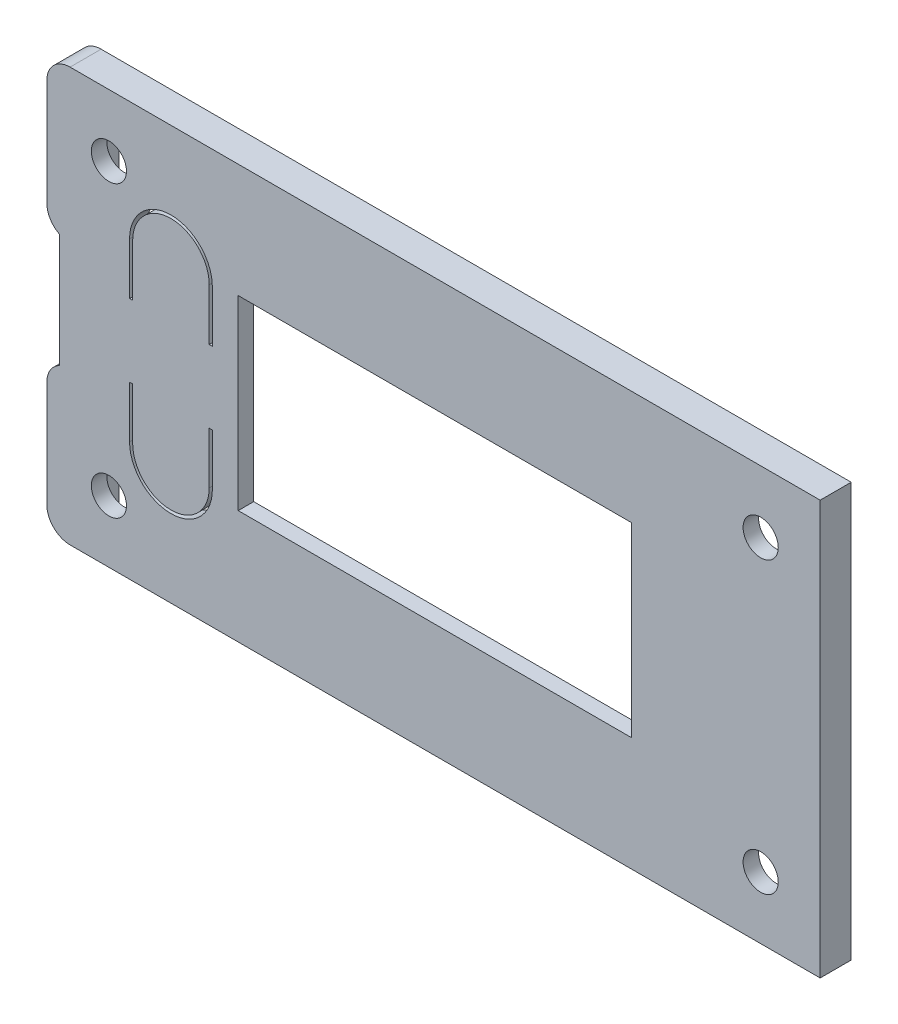
from build123d import *

# Parameters (mm, degrees)
SKETCH1_W           = 74.75
SKETCH1_H           = 40
BOSS_EXTRUDE1_DEPTH = 3
SKETCH2_W           = 2.25
SKETCH2_H           = 10.5
CUT_EXTRUDE1_DEPTH  = 85.832555661
FILLET2_R           = 2.25
FILLET1_R           = 2.25
BOSS_EXTRUDE4_DEPTH = 3.7
SKETCH7_W           = 68.5
SKETCH7_H           = 35.5
OLED_RECESS_DEPTH   = 1.5
SKETCH9_R           = 1.7
SKETCH9_W           = 38
SKETCH9_H           = 18
CUT_EXTRUDE5_DEPTH  = 85.860193848


with BuildPart() as part:
    # Sketch1 → Boss-Extrude1 (new body)
    with BuildSketch(Plane.XY):
        with Locations((37.375, 20)):
            Rectangle(SKETCH1_W, SKETCH1_H)
    extrude(amount=BOSS_EXTRUDE1_DEPTH)

    # Sketch2 → Cut-Extrude1 (cut, through all)
    with BuildSketch(Plane.XY.offset(3)):
        with Locations((1.125, 20)):
            Rectangle(SKETCH2_W, SKETCH2_H)
    extrude(amount=-CUT_EXTRUDE1_DEPTH, mode=Mode.SUBTRACT)

    # Fillet2
    fillet2_edges = [part.edges().sort_by_distance(p)[0] for p in [
        (0, 14.75, 1.5),
        (0, 25.25, 1.5),
    ]]
    fillet(fillet2_edges, radius=FILLET2_R - 0.0001)  # a hair under: the kernel refuses the full size

    # Fillet1
    fillet1_edges = [part.edges().sort_by_distance(p)[0] for p in [
        (0, 40, 1.5),
        (0, 0, 1.5),
    ]]
    fillet(fillet1_edges, radius=FILLET1_R)

    # Sketch6 → Boss-Extrude4 (add)
    with BuildSketch(Plane.XY.offset(3)):
        with BuildLine():
            Line((1.25, 25.484435563), (1.25, 14.515564437))
            ThreePointArc((1.25, 14.515564437), (1.736443763, 14.69060722), (2.25, 14.75))
            Line((2.25, 14.75), (2.25, 25.25))
            ThreePointArc((2.25, 25.25), (1.736443763, 25.30939278), (1.25, 25.484435563))
        make_face()
    extrude(amount=-BOSS_EXTRUDE4_DEPTH)

    # Sketch7 → oled-recess (cut)
    with BuildSketch(Plane(origin=(0, 0, 0), x_dir=(-1, 0, 0), z_dir=(0, 0, -1))):
        with Locations((-38.25, 20)):
            Rectangle(SKETCH7_W, SKETCH7_H)
    extrude(amount=-OLED_RECESS_DEPTH, mode=Mode.SUBTRACT)

    # Sketch9 → Cut-Extrude5 (cut, through all)
    with BuildSketch(Plane.XY.offset(3)):
        with Locations((6, 34)):
            Circle(SKETCH9_R)
        with Locations((69, 34)):
            Circle(SKETCH9_R)
        with Locations((6, 6)):
            Circle(SKETCH9_R)
        with Locations((69, 6)):
            Circle(SKETCH9_R)
        with Locations((37.5, 20)):
            Rectangle(SKETCH9_W, SKETCH9_H)
        with BuildLine():
            Line((8, 28.5), (8, 23.5))
            Line((8, 23.5), (8.3, 23.5))
            Line((8.3, 23.5), (8.3, 28.5))
            ThreePointArc((8.3, 28.5), (12, 32.2), (15.7, 28.5))
            Line((15.7, 28.5), (15.7, 23.5))
            Line((15.7, 23.5), (16, 23.5))
            Line((16, 23.5), (16, 28.5))
            ThreePointArc((16, 28.5), (12, 32.5), (8, 28.5))
        make_face()
        with BuildLine():
            Line((15.7, 16.5), (16, 16.5))
            Line((16, 16.5), (16, 11.5))
            ThreePointArc((16, 11.5), (12, 7.5), (8, 11.5))
            Line((8, 11.5), (8, 16.5))
            Line((8, 16.5), (8.3, 16.5))
            Line((8.3, 16.5), (8.3, 11.5))
            ThreePointArc((8.3, 11.5), (12, 7.8), (15.7, 11.5))
            Line((15.7, 11.5), (15.7, 16.5))
        make_face()
    extrude(amount=-CUT_EXTRUDE5_DEPTH, mode=Mode.SUBTRACT)


solid = part.part
